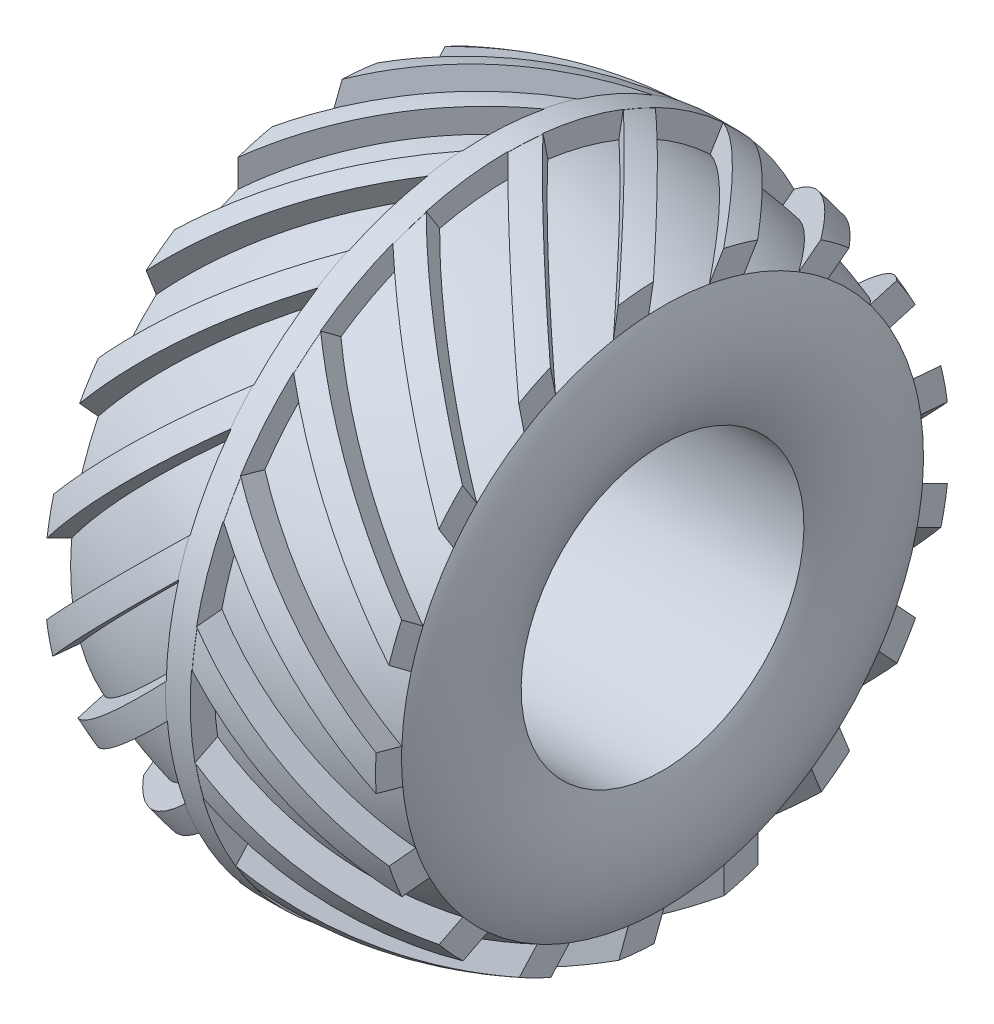
from build123d import *

# Parameters (mm, degrees)
BOSS_EXTRUDE1_REACH      = 104.947
BOSS_EXTRUDE1_END_RADIUS = 53
CIRPATTERN1_COUNT        = 17
BODY_MOVE_COPY2_ANGLE    = 11


with BuildPart() as part:
    # Sketch1 → Revolve1 (revolve)
    with BuildSketch(Plane.XY):
        with BuildLine():
            Line((-27.5, 23.5), (27.5, 23.5))
            ThreePointArc((27.5, 23.5), (30, 33.435982974), (27.5, 43.371965948))
            ThreePointArc((27.5, 43.371965948), (15.01336002, 47.371039344), (2, 48.971422738))
            Line((2, 48.971422738), (2, 53))
            Line((2, 53), (-2, 53))
            Line((-2, 53), (-2, 48.971422738))
            ThreePointArc((-2, 48.971422738), (-15.01336002, 47.371039344), (-27.5, 43.371965948))
            ThreePointArc((-27.5, 43.371965948), (-30, 33.435982974), (-27.5, 23.5))
        make_face()
    revolve(axis=Axis((0, 0, 0), (1, 0, 0)))

    # Boss-Extrude1: up to this cylinder (the profile starts inside it)
    boss_extrude1_end = Plane(origin=(0, 0, 0), z_dir=(-1, 0, 0)) * Cylinder(BOSS_EXTRUDE1_END_RADIUS, 346.394, mode=Mode.PRIVATE)
    # Sketch2 → Boss-Extrude1 (add, up to the surface)
    with BuildSketch(Plane(origin=(0, 30, 0), x_dir=(1, 0, 0), z_dir=(0, 1, 0)), mode=Mode.PRIVATE) as boss_extrude1_sk1:
        Polygon((2, 15.578427125), (27.5, -9.921572875), (27.5, -15.578427125), (2, 9.921572875), align=None)
    boss_extrude1_tool1 = extrude(boss_extrude1_sk1.sketch, amount=BOSS_EXTRUDE1_REACH, mode=Mode.PRIVATE) & boss_extrude1_end
    # Sketch2 → Boss-Extrude1 (add, up to the surface)
    with BuildSketch(Plane(origin=(0, 30, 0), x_dir=(1, 0, 0), z_dir=(0, 1, 0)), mode=Mode.PRIVATE) as boss_extrude1_sk2:
        Polygon((-2, 9.921572875), (-2, 15.578427125), (-27.5, -9.921572875), (-27.5, -15.578427125), align=None)
    boss_extrude1_tool2 = extrude(boss_extrude1_sk2.sketch, amount=BOSS_EXTRUDE1_REACH, mode=Mode.PRIVATE) & boss_extrude1_end
    boss_extrude1 = boss_extrude1_tool1.solids().sort_by_distance((14.75, 30, 0))[0] + boss_extrude1_tool2.solids().sort_by_distance((-14.75, 30, 0))[0]
    add(boss_extrude1)

    # CirPattern1: Boss-Extrude1 ×17 about axis
    cirpattern1_axis = Axis((-27.5, 0, 0), (-1, 0, 0))
    for i in range(1, CIRPATTERN1_COUNT):
        add(boss_extrude1.rotate(cirpattern1_axis, i * 360 / CIRPATTERN1_COUNT))

    # Sketch3 → Cut-Revolve1 (revolve, cut)
    with BuildSketch(Plane.XY):
        with BuildLine():
            Line((-29.071428571, 47.050364002), (-29.071428571, 58.228856353))
            Line((-29.071428571, 58.228856353), (-2.114285714, 58.228856353))
            Line((-2.114285714, 58.228856353), (-2.114285714, 52.969789752))
            ThreePointArc((-2.114285714, 52.969789752), (-15.871266307, 51.277955877), (-29.071428571, 47.050364002))
        make_face()
        with BuildLine():
            Line((2.114285714, 52.969789752), (2.114285714, 58.228856353))
            Line((2.114285714, 58.228856353), (29.071428571, 58.228856353))
            Line((29.071428571, 58.228856353), (29.071428571, 47.050364002))
            ThreePointArc((29.071428571, 47.050364002), (15.871266307, 51.277955877), (2.114285714, 52.969789752))
        make_face()
    revolve(axis=Axis((-200000, 0, 0), (1, 0, 0)), mode=Mode.SUBTRACT)


with BuildPart() as body_2:
    # Split1: the piece on the far side of the plane
    add(part.part)
    split(bisect_by=Plane(origin=(0, 0, 0), x_dir=(0, 0, 1), z_dir=(1, 0, 0)), keep=Keep.BOTTOM)


with BuildPart() as part_1:
    add(part.part)

    # Split1
    split(bisect_by=Plane(origin=(0, 0, 0), x_dir=(0, 0, 1), z_dir=(1, 0, 0)), keep=Keep.TOP)


with BuildPart() as part_2:
    # Body-Move/Copy2: moved
    add(part_1.part.rotate(Axis((0, 0, 0), (1, 0, 0)), BODY_MOVE_COPY2_ANGLE))

    # Combine2: union body 2
    add(body_2.part)


solid = part_2.part
